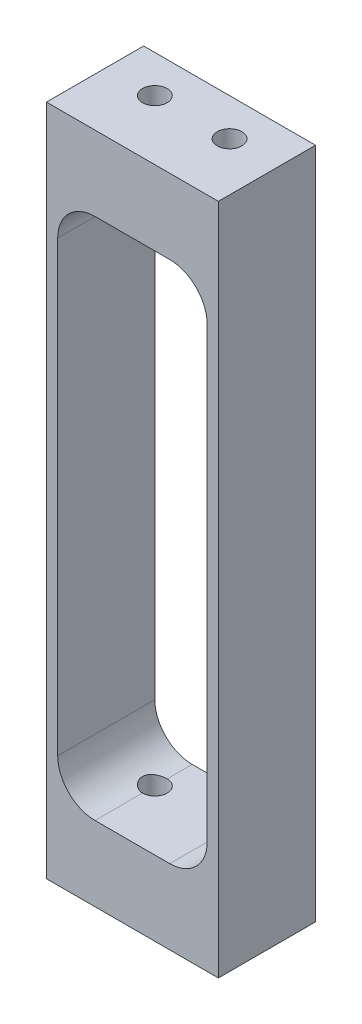
from build123d import *

# Parameters (mm, degrees)
SKETCH1_W             = 23
SKETCH1_H             = 90
BOSS_EXTRUDE1_DEPTH   = 13
SKETCH2_W             = 20
SKETCH2_H             = 70
CUT_EXTRUDE1_DEPTH    = 23
FILLET1_R             = 5
M4X0_7_TAPPED_HOLE1_D = 3.3


with BuildPart() as part:
    # Sketch1 → Boss-Extrude1 (new body)
    with BuildSketch(Plane.XY):
        Rectangle(SKETCH1_W, SKETCH1_H)
    extrude(amount=BOSS_EXTRUDE1_DEPTH)

    # Sketch2 → Cut-Extrude1 (cut)
    with BuildSketch(Plane.XY.offset(13)):
        Rectangle(SKETCH2_W, SKETCH2_H)
    extrude(amount=-CUT_EXTRUDE1_DEPTH, mode=Mode.SUBTRACT)

    # Fillet1
    fillet1_edges = [part.edges().sort_by_distance(p)[0] for p in [
        (-10, 35, 6.5),
        (10, 35, 6.5),
        (10, -35, 6.5),
        (-10, -35, 6.5),
    ]]
    fillet(fillet1_edges, radius=FILLET1_R)

    # M4x0.7 Tapped Hole1 (through all)
    with Locations(Plane(origin=(0, -45, 0), x_dir=(-1, 0, 0), z_dir=(0, -1, 0))):
        with Locations((-5, -5), (5, -5)):
            Hole(M4X0_7_TAPPED_HOLE1_D / 2)


solid = part.part
